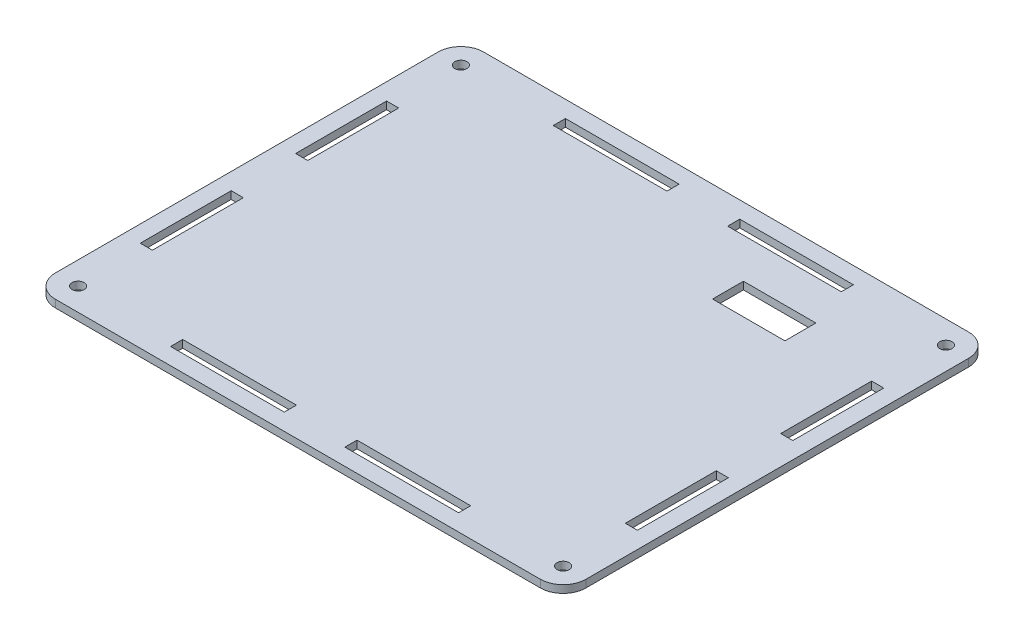
from build123d import *

# Parameters (mm, degrees)
SKETCH1_W           = 140
SKETCH1_H           = 113
SKETCH1_R           = 1.6
SKETCH1_W_2         = 3.2
SKETCH1_H_2         = 24
SKETCH1_W_3         = 30
SKETCH1_H_3         = 3.2
SKETCH1_W_4         = 19.1
SKETCH1_H_4         = 8.149746045
BOSS_EXTRUDE1_DEPTH = 2
FILLET1_R           = 6
FILLET2_R           = 6
FILLET3_R           = 6


with BuildPart() as part:
    # Sketch1 → Boss-Extrude1 (new body)
    with BuildSketch(Plane(origin=(0, 0, 0), x_dir=(1, 0, 0), z_dir=(0, 1, 0))):
        with Locations((70, 56.5)):
            Rectangle(SKETCH1_W, SKETCH1_H)
        with Locations((6, 107)):
            Circle(SKETCH1_R, mode=Mode.SUBTRACT)
        with Locations((134, 107)):
            Circle(SKETCH1_R, mode=Mode.SUBTRACT)
        with Locations((134, 6)):
            Circle(SKETCH1_R, mode=Mode.SUBTRACT)
        with Locations((6, 6)):
            Circle(SKETCH1_R, mode=Mode.SUBTRACT)
        with Locations((134, 36)):
            Rectangle(SKETCH1_W_2, SKETCH1_H_2, mode=Mode.SUBTRACT)
        with Locations((47, 6)):
            Rectangle(SKETCH1_W_3, SKETCH1_H_3, mode=Mode.SUBTRACT)
        with Locations((47, 107)):
            Rectangle(SKETCH1_W_3, SKETCH1_H_3, mode=Mode.SUBTRACT)
        with Locations((93, 6)):
            Rectangle(SKETCH1_W_3, SKETCH1_H_3, mode=Mode.SUBTRACT)
        with Locations((6, 77)):
            Rectangle(SKETCH1_W_2, SKETCH1_H_2, mode=Mode.SUBTRACT)
        with Locations((6, 36)):
            Rectangle(SKETCH1_W_2, SKETCH1_H_2, mode=Mode.SUBTRACT)
        with Locations((93, 107)):
            Rectangle(SKETCH1_W_3, SKETCH1_H_3, mode=Mode.SUBTRACT)
        with Locations((134, 77)):
            Rectangle(SKETCH1_W_2, SKETCH1_H_2, mode=Mode.SUBTRACT)
        with Locations((102.22, 90.825126978)):
            Rectangle(SKETCH1_W_4, SKETCH1_H_4, mode=Mode.SUBTRACT)
    extrude(amount=BOSS_EXTRUDE1_DEPTH)

    # Fillet1
    fillet1_edges = [part.edges().sort_by_distance(p)[0] for p in [
        (0, 1, -113),
    ]]
    fillet(fillet1_edges, radius=FILLET1_R)

    # Fillet2
    fillet2_edges = [part.edges().sort_by_distance(p)[0] for p in [
        (0, 1, 0),
    ]]
    fillet(fillet2_edges, radius=FILLET2_R)

    # Fillet3
    fillet3_edges = [part.edges().sort_by_distance(p)[0] for p in [
        (140, 1, -113),
        (140, 1, 0),
    ]]
    fillet(fillet3_edges, radius=FILLET3_R)


solid = part.part
